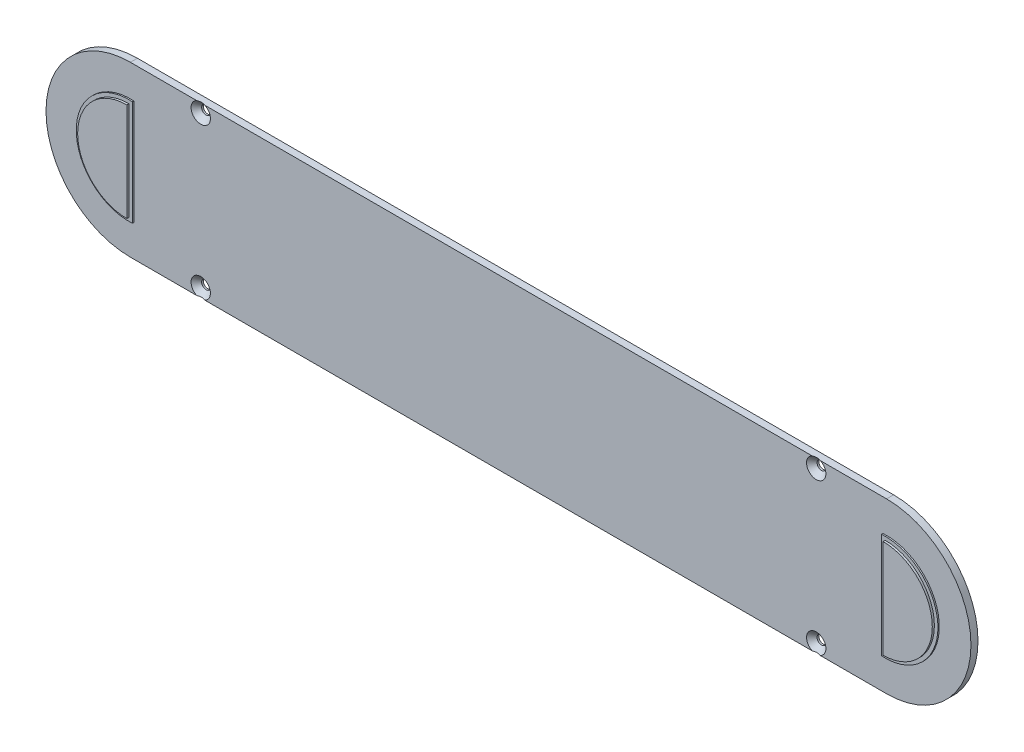
from build123d import *

# Parameters (mm, degrees)
CROQUIS2_R              = 1.25
SALIENTE_EXTRUIR1_DEPTH = 2
CHAFL_N1_SIZE           = 1.5
SALIENTE_EXTRUIR2_DEPTH = 1
SALIENTE_EXTRUIR3_DEPTH = 0.4


with BuildPart() as part:
    # Croquis2 → Saliente-Extruir1 (new body)
    with BuildSketch(Plane.XY.offset(2)):
        with BuildLine():
            Line((-107.5, -24), (107.5, -24))
            ThreePointArc((107.5, -24), (131.5, 0), (107.5, 24))
            Line((107.5, 24), (-107.5, 24))
            ThreePointArc((-107.5, 24), (-131.5, 0), (-107.5, -24))
        make_face()
        with Locations((-87.5, -21.5)):
            Circle(CROQUIS2_R, mode=Mode.SUBTRACT)
        with Locations((-87.5, 21.5)):
            Circle(CROQUIS2_R, mode=Mode.SUBTRACT)
        with Locations((87.5, 21.5)):
            Circle(CROQUIS2_R, mode=Mode.SUBTRACT)
        with Locations((87.5, -21.5)):
            Circle(CROQUIS2_R, mode=Mode.SUBTRACT)
    extrude(amount=-SALIENTE_EXTRUIR1_DEPTH)

    # Chaflán1
    # the kernel refuses this chamfer: 1.5 mm, written as the material it takes off along each edge
    with BuildSketch(Plane(origin=(-87.5, -21.5, 2), x_dir=(1, 0, 0), z_dir=(0, -1, 0))) as chafl_n1_piece_1:
        Polygon((1.25, -CHAFL_N1_SIZE), (1.25 + CHAFL_N1_SIZE, 0), (1.25, 0), align=None)
    revolve(axis=Axis((-87.5, -21.5, 2), (0, 0, 1)), mode=Mode.SUBTRACT)
    with BuildSketch(Plane(origin=(-87.5, 21.5, 2), x_dir=(1, 0, 0), z_dir=(0, -1, 0))) as chafl_n1_piece_2:
        Polygon((1.25, -CHAFL_N1_SIZE), (1.25 + CHAFL_N1_SIZE, 0), (1.25, 0), align=None)
    revolve(axis=Axis((-87.5, 21.5, 2), (0, 0, 1)), mode=Mode.SUBTRACT)
    with BuildSketch(Plane(origin=(87.5, 21.5, 2), x_dir=(1, 0, 0), z_dir=(0, -1, 0))) as chafl_n1_piece_3:
        Polygon((1.25, -CHAFL_N1_SIZE), (1.25 + CHAFL_N1_SIZE, 0), (1.25, 0), align=None)
    revolve(axis=Axis((87.5, 21.5, 2), (0, 0, 1)), mode=Mode.SUBTRACT)
    with BuildSketch(Plane(origin=(87.5, -21.5, 2), x_dir=(1, 0, 0), z_dir=(0, -1, 0))) as chafl_n1_piece_4:
        Polygon((1.25, -CHAFL_N1_SIZE), (1.25 + CHAFL_N1_SIZE, 0), (1.25, 0), align=None)
    revolve(axis=Axis((87.5, -21.5, 2), (0, 0, 1)), mode=Mode.SUBTRACT)

    # Croquis3 → Saliente-Extruir2 (add)
    with BuildSketch(Plane.XY.offset(2)):
        with BuildLine():
            Line((-107.5, 14), (-107.5, -14))
            ThreePointArc((-107.5, -14), (-121.5, 0), (-107.5, 14))
        make_face()
        with BuildLine():
            Line((107.5, 14), (107.5, -14))
            ThreePointArc((107.5, -14), (121.5, 0), (107.5, 14))
        make_face()
    extrude(amount=SALIENTE_EXTRUIR2_DEPTH)

    # Croquis4 → Saliente-Extruir3 (add)
    # profile 1 of 2: a face of its own
    with BuildSketch(Plane.XY.offset(2)):
        with BuildLine():
            Line((-106.5, -14.966629547), (-106.5, 14.966629547))
            ThreePointArc((-106.5, 14.966629547), (-122.5, 0), (-106.5, -14.966629547))
        make_face()
        with BuildLine():
            Line((-107.5, -14), (-107.5, 14))
            ThreePointArc((-107.5, 14), (-121.5, 0), (-107.5, -14))
        make_face(mode=Mode.SUBTRACT)
    # profile 2 of 2: a face of its own
    with BuildSketch(Plane.XY.offset(2)):
        with BuildLine():
            Line((106.5, 14.966629547), (106.5, -14.966629547))
            ThreePointArc((106.5, -14.966629547), (122.5, 0), (106.5, 14.966629547))
        make_face()
        with BuildLine():
            Line((107.5, 14), (107.5, -14))
            ThreePointArc((107.5, -14), (121.5, 0), (107.5, 14))
        make_face(mode=Mode.SUBTRACT)
    extrude(amount=SALIENTE_EXTRUIR3_DEPTH)


solid = part.part
